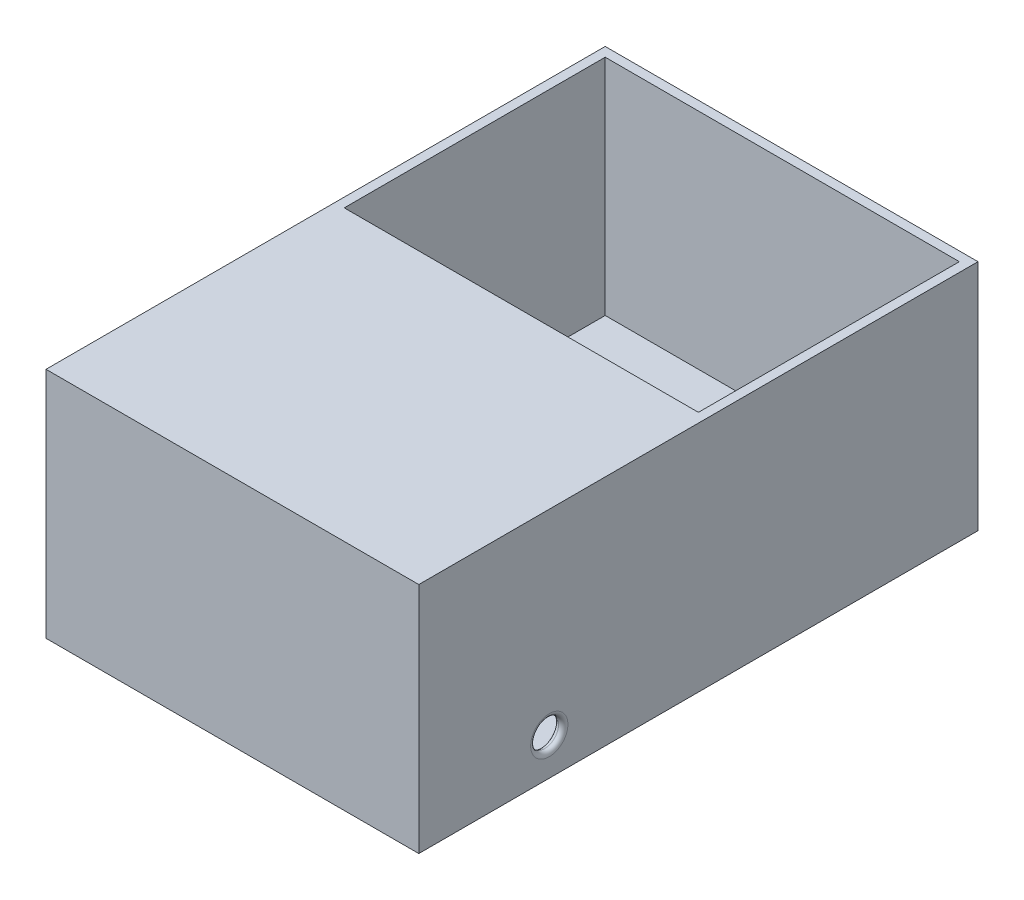
from build123d import *

# Parameters (mm, degrees)
SKETCH2_W           = 200
SKETCH2_H           = 300
BOSS_EXTRUDE1_DEPTH = 5
SKETCH4_W           = 200
SKETCH4_H           = 300
SKETCH4_W_2         = 190
SKETCH4_H_2         = 290
BOSS_EXTRUDE2_DEPTH = 120
SKETCH5_W           = 190
SKETCH5_H           = 5
BOSS_EXTRUDE3_DEPTH = 150
SKETCH7_R           = 7.5
CUT_EXTRUDE1_DEPTH  = 215
FILLET4_R           = 2.5


with BuildPart() as part:
    # Sketch2 → Boss-Extrude1 (new body)
    with BuildSketch(Plane(origin=(0, 0, 0), x_dir=(1, 0, 0), z_dir=(0, 1, 0))):
        Rectangle(SKETCH2_W, SKETCH2_H)
    extrude(amount=BOSS_EXTRUDE1_DEPTH)

    # Sketch4 → Boss-Extrude2 (add)
    with BuildSketch(Plane(origin=(0, 5, 0), x_dir=(1, 0, 0), z_dir=(0, 1, 0))):
        Rectangle(SKETCH4_W, SKETCH4_H)
        Rectangle(SKETCH4_W_2, SKETCH4_H_2, mode=Mode.SUBTRACT)
    extrude(amount=BOSS_EXTRUDE2_DEPTH)

    # Sketch5 → Boss-Extrude3 (add)
    with BuildSketch(Plane(origin=(0, 0, 145), x_dir=(-1, 0, 0), z_dir=(0, 0, -1))):
        with Locations((0, 122.5)):
            Rectangle(SKETCH5_W, SKETCH5_H)
    extrude(amount=BOSS_EXTRUDE3_DEPTH)

    # Sketch7 → Cut-Extrude1 (cut, symmetric)
    with BuildSketch(Plane(origin=(-95, 0, 0), x_dir=(0, 0, -1), z_dir=(1, 0, 0))):
        with Locations(Location((-80, 20, 0), (0, 0, 180))):
            Circle(SKETCH7_R)
    extrude(amount=CUT_EXTRUDE1_DEPTH, both=True, mode=Mode.SUBTRACT)

    # Fillet4
    fillet4_edges = [part.edges().sort_by_distance(p)[0] for p in [
        (95, 20, 72.5),
        (-95, 20, 72.5),
        (-100, 20, 72.5),
        (100, 20, 72.5),
    ]]
    fillet(fillet4_edges, radius=FILLET4_R - 0.0001)  # a hair under: the kernel refuses the full size


solid = part.part
